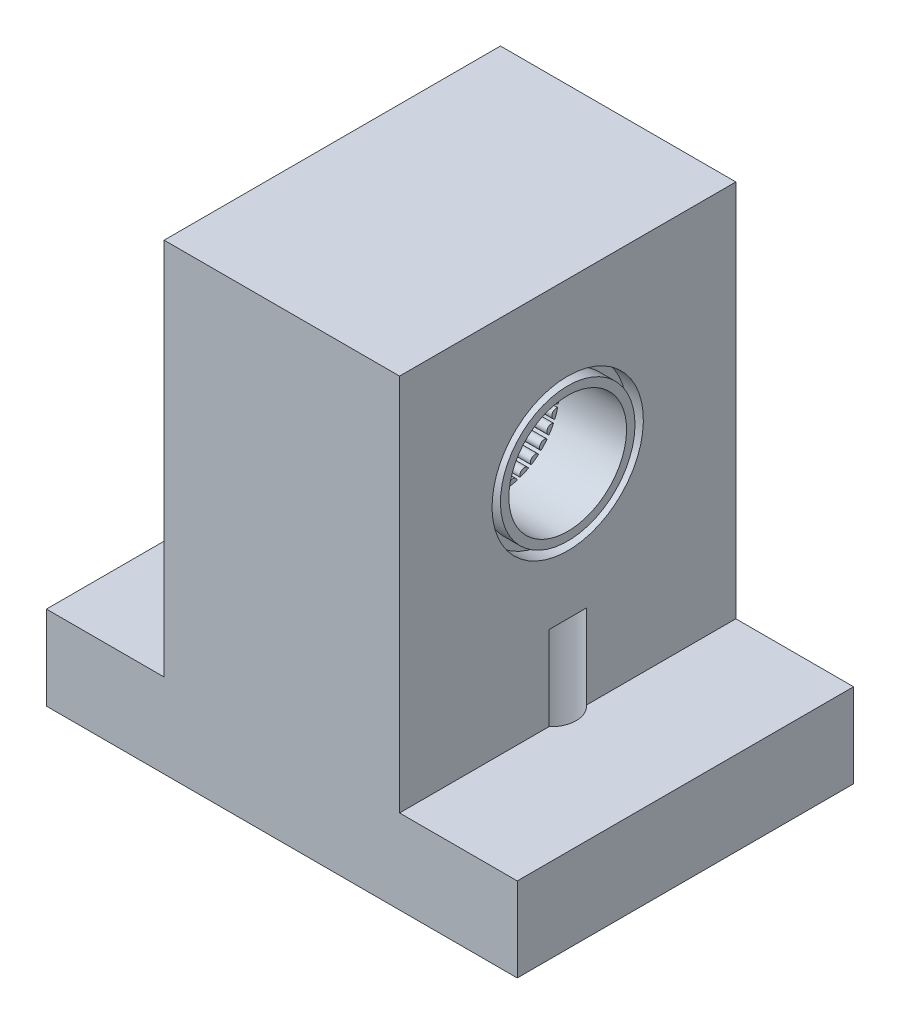
from build123d import *

# Parameters (mm, degrees)
SALIENTE_EXTRUIR1_DEPTH      = 10
CROQUIS4_R                   = 3.5
CORTAR_EXTRUIR3_DEPTH        = 15
CROQUIS5_R                   = 1.5
CORTAR_EXTRUIR4_DEPTH        = 10
SALIENTE_EXTRUIR2_DEPTH      = 3
SALIENTE_EXTRUIR2_DEPTH_BACK = 3
CROQUIS7_R                   = 4.5
CROQUIS7_R_2                 = 4
CORTAR_EXTRUIR5_DEPTH        = 1


with BuildPart() as part:
    # Croquis1 → Saliente-Extruir1 (new, symmetric)
    with BuildSketch(Plane.XY):
        Polygon((7, -8.75), (7, 13.75), (-7, 13.75), (-7, -8.75), (-14, -8.75), (-14, -13.75), (14, -13.75), (14, -8.75), align=None)
    extrude(amount=SALIENTE_EXTRUIR1_DEPTH, both=True)

    # Croquis4 → Cortar-Extruir3 (cut)
    with BuildSketch(Plane(origin=(7, 0, 0), x_dir=(0, 0, -1), z_dir=(1, 0, 0))):
        with Locations((0, 4.25)):
            Circle(CROQUIS4_R)
    extrude(amount=-CORTAR_EXTRUIR3_DEPTH, mode=Mode.SUBTRACT)

    # Croquis5 → Cortar-Extruir4 (cut)
    with BuildSketch(Plane.XZ.offset(13.75)):
        with Locations((-6, 0)):
            Circle(CROQUIS5_R)
        with Locations((6, 0)):
            Circle(CROQUIS5_R)
    extrude(amount=-CORTAR_EXTRUIR4_DEPTH, mode=Mode.SUBTRACT)

    # Croquis6 → Saliente-Extruir2 (add, two sides: drawn at the far end of the back side and taken through both)
    with BuildSketch(Plane(origin=(0, 0, 0), x_dir=(0, 0, -1), z_dir=(1, 0, 0)).offset(-SALIENTE_EXTRUIR2_DEPTH_BACK)):
        with BuildLine():
            ThreePointArc((0.274787705, 7.739196429), (0, 7.75), (-0.274787705, 7.739196429))
            ThreePointArc((-0.274787705, 7.739196429), (0, 7.475), (0.274787705, 7.739196429))
        make_face()
        with BuildLine():
            ThreePointArc((0.994227663, 7.605817539), (0.727690918, 7.673516603), (0.456661795, 7.720080691))
            ThreePointArc((0.456661795, 7.720080691), (0.670515203, 7.404526012), (0.994227663, 7.605817539))
        make_face()
        with BuildLine():
            ThreePointArc((1.670215102, 7.325773319), (1.423578251, 7.447409102), (1.168152983, 7.549305777))
            ThreePointArc((1.168152983, 7.549305777), (1.311725674, 7.196184101), (1.670215102, 7.325773319))
        make_face()
        with BuildLine():
            ThreePointArc((2.273206126, 6.911303047), (2.057248383, 7.08155948), (1.82859028, 7.234335368))
            ThreePointArc((1.82859028, 7.234335368), (1.895607439, 6.859079807), (2.273206126, 6.911303047))
        make_face()
        with BuildLine():
            ThreePointArc((2.776847135, 6.380521061), (2.601006889, 6.591957122), (2.409109407, 6.788935183))
            ThreePointArc((2.409109407, 6.788935183), (2.396642062, 6.407946206), (2.776847135, 6.380521061))
        make_face()
        with BuildLine():
            ThreePointArc((3.159126598, 5.756625081), (3.031088913, 6), (2.884338893, 6.232571348))
            ThreePointArc((2.884338893, 6.232571348), (2.792931927, 5.8625), (3.159126598, 5.756625081))
        make_face()
        with BuildLine():
            ThreePointArc((3.403337071, 5.066882356), (3.328697807, 5.33155948), (3.233508929, 5.589559631))
            ThreePointArc((3.233508929, 5.589559631), (3.067157265, 5.246579807), (3.403337071, 5.066882356))
        make_face()
        with BuildLine():
            ThreePointArc((3.498805382, 4.341437951), (3.480826634, 4.615849621), (3.441359109, 4.88800273))
            ThreePointArc((3.441359109, 4.88800273), (3.207333113, 4.587104294), (3.498805382, 4.341437951))
        make_face()
        with BuildLine():
            ThreePointArc((3.441359109, 3.61199727), (3.480826634, 3.884150379), (3.498805382, 4.158562049))
            ThreePointArc((3.498805382, 4.158562049), (3.207333113, 3.912895706), (3.441359109, 3.61199727))
        make_face()
        with BuildLine():
            ThreePointArc((3.233508929, 2.910440369), (3.328697807, 3.16844052), (3.403337071, 3.433117644))
            ThreePointArc((3.403337071, 3.433117644), (3.067157265, 3.253420193), (3.233508929, 2.910440369))
        make_face()
        with BuildLine():
            ThreePointArc((2.884338893, 2.267428652), (3.031088913, 2.5), (3.159126598, 2.743374919))
            ThreePointArc((3.159126598, 2.743374919), (2.792931927, 2.6375), (2.884338893, 2.267428652))
        make_face()
        with BuildLine():
            ThreePointArc((2.409109407, 1.711064817), (2.601006889, 1.908042878), (2.776847135, 2.119478939))
            ThreePointArc((2.776847135, 2.119478939), (2.396642062, 2.092053794), (2.409109407, 1.711064817))
        make_face()
        with BuildLine():
            ThreePointArc((1.82859028, 1.265664632), (2.057248383, 1.41844052), (2.273206126, 1.588696953))
            ThreePointArc((2.273206126, 1.588696953), (1.895607439, 1.640920193), (1.82859028, 1.265664632))
        make_face()
        with BuildLine():
            ThreePointArc((1.168152983, 0.950694223), (1.423578251, 1.052590898), (1.670215102, 1.174226681))
            ThreePointArc((1.670215102, 1.174226681), (1.311725674, 1.303815899), (1.168152983, 0.950694223))
        make_face()
        with BuildLine():
            ThreePointArc((0.456661795, 0.779919309), (0.727690918, 0.826483397), (0.994227663, 0.894182461))
            ThreePointArc((0.994227663, 0.894182461), (0.670515203, 1.095473988), (0.456661795, 0.779919309))
        make_face()
        with BuildLine():
            ThreePointArc((-0.274787705, 0.760803571), (0, 0.75), (0.274787705, 0.760803571))
            ThreePointArc((0.274787705, 0.760803571), (0, 1.025), (-0.274787705, 0.760803571))
        make_face()
        with BuildLine():
            ThreePointArc((-0.994227663, 0.894182461), (-0.727690918, 0.826483397), (-0.456661795, 0.779919309))
            ThreePointArc((-0.456661795, 0.779919309), (-0.670515203, 1.095473988), (-0.994227663, 0.894182461))
        make_face()
        with BuildLine():
            ThreePointArc((-1.670215102, 1.174226681), (-1.423578251, 1.052590898), (-1.168152983, 0.950694223))
            ThreePointArc((-1.168152983, 0.950694223), (-1.311725674, 1.303815899), (-1.670215102, 1.174226681))
        make_face()
        with BuildLine():
            ThreePointArc((-2.273206126, 1.588696953), (-2.057248383, 1.41844052), (-1.82859028, 1.265664632))
            ThreePointArc((-1.82859028, 1.265664632), (-1.895607439, 1.640920193), (-2.273206126, 1.588696953))
        make_face()
        with BuildLine():
            ThreePointArc((-2.776847135, 2.119478939), (-2.601006889, 1.908042878), (-2.409109407, 1.711064817))
            ThreePointArc((-2.409109407, 1.711064817), (-2.396642062, 2.092053794), (-2.776847135, 2.119478939))
        make_face()
        with BuildLine():
            ThreePointArc((-3.159126598, 2.743374919), (-3.031088913, 2.5), (-2.884338893, 2.267428652))
            ThreePointArc((-2.884338893, 2.267428652), (-2.792931927, 2.6375), (-3.159126598, 2.743374919))
        make_face()
        with BuildLine():
            ThreePointArc((-3.403337071, 3.433117644), (-3.328697807, 3.16844052), (-3.233508929, 2.910440369))
            ThreePointArc((-3.233508929, 2.910440369), (-3.067157265, 3.253420193), (-3.403337071, 3.433117644))
        make_face()
        with BuildLine():
            ThreePointArc((-3.498805382, 4.158562049), (-3.480826634, 3.884150379), (-3.441359109, 3.61199727))
            ThreePointArc((-3.441359109, 3.61199727), (-3.207333113, 3.912895706), (-3.498805382, 4.158562049))
        make_face()
        with BuildLine():
            ThreePointArc((-3.441359109, 4.88800273), (-3.480826634, 4.615849621), (-3.498805382, 4.341437951))
            ThreePointArc((-3.498805382, 4.341437951), (-3.207333113, 4.587104294), (-3.441359109, 4.88800273))
        make_face()
        with BuildLine():
            ThreePointArc((-3.233508929, 5.589559631), (-3.328697807, 5.33155948), (-3.403337071, 5.066882356))
            ThreePointArc((-3.403337071, 5.066882356), (-3.067157265, 5.246579807), (-3.233508929, 5.589559631))
        make_face()
        with BuildLine():
            ThreePointArc((-2.884338893, 6.232571348), (-3.031088913, 6), (-3.159126598, 5.756625081))
            ThreePointArc((-3.159126598, 5.756625081), (-2.792931927, 5.8625), (-2.884338893, 6.232571348))
        make_face()
        with BuildLine():
            ThreePointArc((-2.409109407, 6.788935183), (-2.601006889, 6.591957122), (-2.776847135, 6.380521061))
            ThreePointArc((-2.776847135, 6.380521061), (-2.396642062, 6.407946206), (-2.409109407, 6.788935183))
        make_face()
        with BuildLine():
            ThreePointArc((-1.82859028, 7.234335368), (-2.057248383, 7.08155948), (-2.273206126, 6.911303047))
            ThreePointArc((-2.273206126, 6.911303047), (-1.895607439, 6.859079807), (-1.82859028, 7.234335368))
        make_face()
        with BuildLine():
            ThreePointArc((-1.168152983, 7.549305777), (-1.423578251, 7.447409102), (-1.670215102, 7.325773319))
            ThreePointArc((-1.670215102, 7.325773319), (-1.311725674, 7.196184101), (-1.168152983, 7.549305777))
        make_face()
        with BuildLine():
            ThreePointArc((-0.456661795, 7.720080691), (-0.727690918, 7.673516603), (-0.994227663, 7.605817539))
            ThreePointArc((-0.994227663, 7.605817539), (-0.670515203, 7.404526012), (-0.456661795, 7.720080691))
        make_face()
    extrude(amount=SALIENTE_EXTRUIR2_DEPTH + SALIENTE_EXTRUIR2_DEPTH_BACK)

    # Croquis7 → Cortar-Extruir5 (cut)
    with BuildSketch(Plane(origin=(7, 0, 0), x_dir=(0, 0, -1), z_dir=(1, 0, 0))):
        with Locations((0, 4.25)):
            Circle(CROQUIS7_R)
        with Locations((0, 4.25)):
            Circle(CROQUIS7_R_2, mode=Mode.SUBTRACT)
    cortar_extruir5 = extrude(amount=-CORTAR_EXTRUIR5_DEPTH, mode=Mode.SUBTRACT)

    # Simetría1: Cortar-Extruir5 across plane
    add(cortar_extruir5.mirror(Plane(origin=(0, 0, 0), x_dir=(0, 0, 1), z_dir=(1, 0, 0))), mode=Mode.SUBTRACT)


solid = part.part
